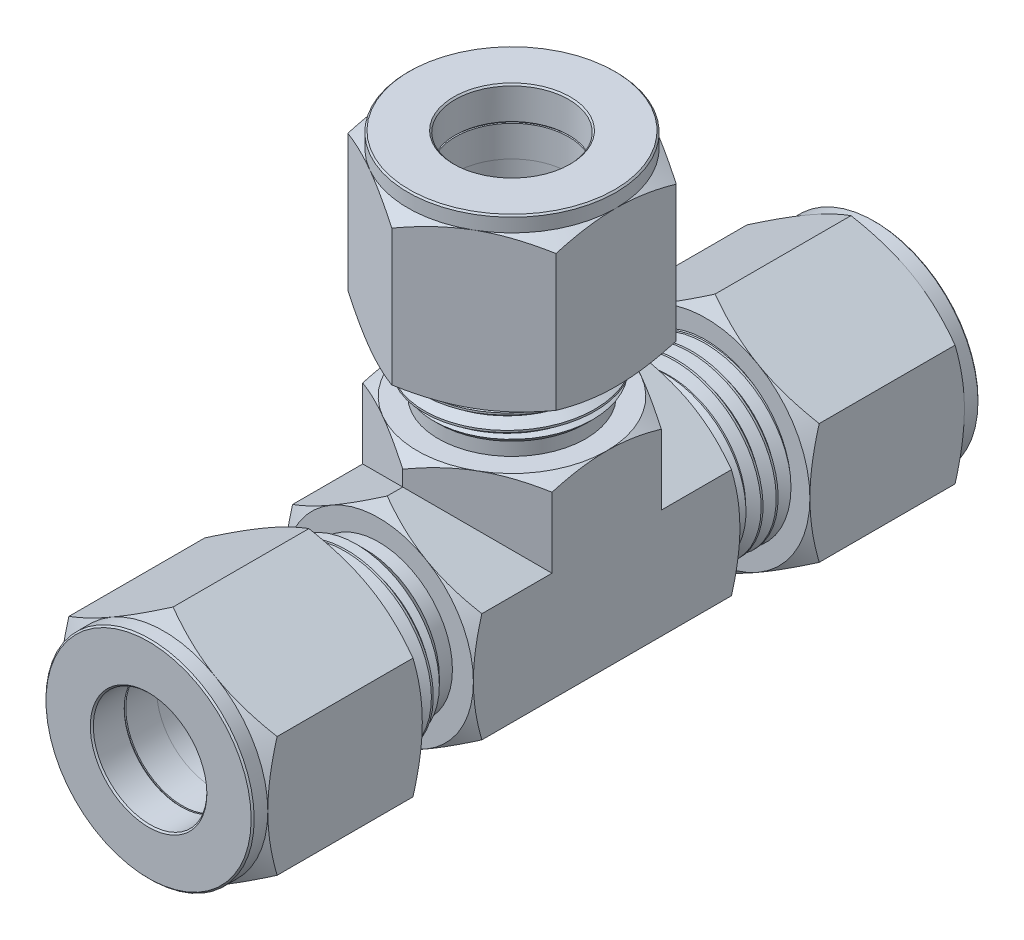
from build123d import *

# Parameters (mm, degrees)
BOSS_EXTRUDE1_DEPTH    = 14.224
CHAMFER1_SIZE          = 0.127
SKETCH4_W              = 23.114
SKETCH4_H              = 7.14375
CUT_SWEEP1_PITCH       = 1.27
CUT_SWEEP1_FROM        = 0
BOSS_EXTRUDE2_DEPTH    = 11.176
CIRPATTERN1_COUNT      = 3
CIRPATTERN1_ANGLE      = 180
SKETCH12_R             = 3.5687
CUT_EXTRUDE1_DEPTH     = 46.228
CUT_EXTRUDE2_START     = -23.1140001
CUT_EXTRUDE2_OUTLINE_R = 3.5687
CUT_EXTRUDE2_DEPTH     = 13.4620002


with BuildPart() as part:
    # Sketch2 → Boss-Extrude1 (new body)
    with BuildSketch(Plane.XY):
        Polygon((0, 10.081979076), (-8.73125, 5.040989538), (-8.73125, -5.040989538), (0, -10.081979076), (8.73125, -5.040989538), (8.73125, 5.040989538), align=None)
    extrude(amount=-BOSS_EXTRUDE1_DEPTH)

    # Sketch3 → Cut-Revolve1 (revolve, cut)
    with BuildSketch(Plane(origin=(0, 0, 0), x_dir=(0, 0, -1), z_dir=(1, 0, 0)), mode=Mode.PRIVATE) as cut_revolve1_sk:
        Polygon((0, 10.081979076), (0, 8.73125), (1.27, 8.73125), (2.049843795, 10.081979076), (13.444156205, 10.081979076), (14.224, 8.73125), (14.224, 10.081979076), (14.224, 11.432708151), (0, 11.432708151), align=None)
        Polygon((0, 4.7625), (0, 0), (14.224, 0), (14.224, 7.14375), (5.6896, 7.14375), (5.6896, 6.50875), (2.8448, 6.50875), (2.8448, 5.87375), (2.8448, 4.7625), align=None)
    revolve(cut_revolve1_sk.sketch.rotate(Axis((0, 0, 0), (0, 0, -1)), 90), axis=Axis((0, 0, 0), (0, 0, -1)), mode=Mode.SUBTRACT)

    # Chamfer1
    chamfer1_edges = [part.edges().sort_by_distance(p)[0] for p in [
        (-8.73125, 0, 0),
        (-4.7625, 0, -2.8448),
        (-4.7625, 0, 0),
    ]]
    chamfer(chamfer1_edges, length=CHAMFER1_SIZE)


with BuildPart() as body_2:
    # Sketch4 → Revolve1 (revolve)
    with BuildSketch(Plane(origin=(0, 0, 0), x_dir=(0, 0, -1), z_dir=(1, 0, 0)), mode=Mode.PRIVATE) as revolve1_sk:
        with Locations((18.923, 3.571875)):
            Rectangle(SKETCH4_W, SKETCH4_H)
    revolve(revolve1_sk.sketch.rotate(Axis((0, 0, -30.48), (0, 0, 1)), 90), axis=Axis((0, 0, -30.48), (0, 0, 1)))

    # Cut-Sweep1: arcs per turn and ends read off the stored shape
    # Cut-Sweep1: the profile of Sketch6 screwed along a right-hand helix through 20.2 turns, 8 arcs to a turn; built about Z, then put on its axis
    cut_sweep1_z = Axis((0, 0, 0), (0, 0, 1))
    cut_sweep1_corners = [(6.318860803, 0, -1.905), (7.212490766, 0, -2.4209375), (7.212490766, 0, -1.2303125), (6.318860803, 0, -1.74625)]
    with BuildLine(mode=Mode.PRIVATE) as cut_sweep1_profile:
        Line(cut_sweep1_corners[0], cut_sweep1_corners[1])
        Line(cut_sweep1_corners[1], cut_sweep1_corners[2])
        Line(cut_sweep1_corners[2], cut_sweep1_corners[3])
        Line(cut_sweep1_corners[3], cut_sweep1_corners[0])
    cut_sweep1_cap = Face(cut_sweep1_profile.wire())
    cut_sweep1_turn_angles = [0, 22.5, 45, 67.5, 90, 112.5, 135, 157.5, 180, 202.5, 225, 247.5, 270, 292.5, 315, 337.5, 360]
    cut_sweep1_turn_weights = [1, 0.9238795325112867, 1, 0.9238795325112867, 1, 0.9238795325112867, 1, 0.9238795325112867, 1, 0.9238795325112867, 1, 0.9238795325112867, 1, 0.9238795325112867, 1, 0.9238795325112867, 1]
    cut_sweep1_turn_rails = [Edge.make_bspline([Vector(p[0], p[1], 0).rotate(cut_sweep1_z, cut_sweep1_turn_angles[k]) / cut_sweep1_turn_weights[k] + Vector(0, 0, p[2] + CUT_SWEEP1_PITCH * cut_sweep1_turn_angles[k] / 360) for k in range(17)], [0, 0, 0, 1, 1, 2, 2, 3, 3, 4, 4, 5, 5, 6, 6, 7, 7, 8, 8, 8], 2, cut_sweep1_turn_weights) for p in cut_sweep1_corners]
    cut_sweep1_turn_sides = [Face.make_surface_from_curves(cut_sweep1_turn_rails[p[0]], cut_sweep1_turn_rails[p[1]]) for p in [(0, 1), (1, 2), (2, 3), (3, 0)]]
    cut_sweep1_last_angles = [7200, 7222.5, 7245, 7258.5, 7272]
    cut_sweep1_last_weights = [1, 0.9238795325112867, 1, 0.9723699203976766, 1]
    cut_sweep1_last_rails = [Edge.make_bspline([Vector(p[0], p[1], 0).rotate(cut_sweep1_z, cut_sweep1_last_angles[k]) / cut_sweep1_last_weights[k] + Vector(0, 0, p[2] + CUT_SWEEP1_PITCH * cut_sweep1_last_angles[k] / 360) for k in range(5)], [0, 0, 0, 1, 1, 2, 2, 2], 2, cut_sweep1_last_weights) for p in cut_sweep1_corners]
    cut_sweep1_last_sides = [Face.make_surface_from_curves(cut_sweep1_last_rails[p[0]], cut_sweep1_last_rails[p[1]]) for p in [(0, 1), (1, 2), (2, 3), (3, 0)]]
    cut_sweep1 = Plane(origin=(0, 0, -7.366), x_dir=(0, 1, 0), z_dir=(0, 0, -1)) * split(Solid(Shell([*[p.moved(Location((0, 0, CUT_SWEEP1_PITCH * i))) for i in range(20) for p in cut_sweep1_turn_sides], *cut_sweep1_last_sides, cut_sweep1_cap, cut_sweep1_cap.rotate(cut_sweep1_z, 7272).moved(Location((0, 0, CUT_SWEEP1_PITCH * 7272 / 360)))])), bisect_by=Plane.XY.offset(CUT_SWEEP1_FROM), keep=Keep.TOP, mode=Mode.PRIVATE)
    add(cut_sweep1, mode=Mode.SUBTRACT)

    # Sketch7 → Boss-Extrude2 (add)
    with BuildSketch(Plane(origin=(0, 0, -30.48), x_dir=(-1, 0, 0), z_dir=(0, 0, -1))):
        Polygon((0, 9.165435523), (-7.9375, 4.582717762), (-7.9375, -4.582717762), (0, -9.165435523), (7.9375, -4.582717762), (7.9375, 4.582717762), align=None)
    extrude(amount=-BOSS_EXTRUDE2_DEPTH)

    # Sketch8 → Cut-Revolve2 (revolve, cut)
    with BuildSketch(Plane(origin=(0, 0, 0), x_dir=(0, 0, -1), z_dir=(1, 0, 0)), mode=Mode.PRIVATE) as cut_revolve2_sk:
        Polygon((7.366, 7.281231533), (7.366, 6.18137927), (8.465852263, 7.281231533), align=None)
        Polygon((19.304, 7.281231533), (17.104295474, 7.281231533), (18.204147737, 6.18137927), (19.304, 6.18137927), align=None)
        Polygon((19.304, 7.9375), (20.012948905, 9.165435523), (30.48, 9.165435523), (30.48, 10.393371047), (19.304, 10.393371047), (19.304, 9.165435523), align=None)
        Polygon((17.018, 3.5687), (30.48, 3.5687), (30.48, 0), (7.366, 0), (7.366, 5.642404948), (10.922668421, 4.7625), (17.018, 4.7625), align=None)
    revolve(cut_revolve2_sk.sketch.rotate(Axis((0, 0, 0), (0, 0, -1)), 90), axis=Axis((0, 0, 0), (0, 0, -1)), mode=Mode.SUBTRACT)


with BuildPart() as body_3:
    # Sketch9 → Revolve2 (revolve)
    with BuildSketch(Plane(origin=(0, 0, 0), x_dir=(0, 0, -1), z_dir=(1, 0, 0)), mode=Mode.PRIVATE) as revolve2_sk:
        Polygon((4.7625, 6.2865), (4.7625, 5.4356), (5.4356, 4.7625), (9.6393, 4.7625), (9.6393, 5.08), align=None)
    revolve(revolve2_sk.sketch.rotate(Axis((0, 0, 0), (0, 0, -1)), 90), axis=Axis((0, 0, 0), (0, 0, -1)))


with BuildPart() as body_4:
    # Sketch10 → Revolve3 (revolve)
    with BuildSketch(Plane(origin=(0, 0, 0), x_dir=(0, 0, -1), z_dir=(1, 0, 0)), mode=Mode.PRIVATE) as revolve3_sk:
        Polygon((2.8448, 6.223), (3.9878, 6.223), (3.9878, 5.4356), (4.7625, 5.4356), (5.4356, 4.7625), (2.8448, 4.7625), align=None)
    revolve(revolve3_sk.sketch.rotate(Axis((0, 0, 0), (0, 0, -1)), 90), axis=Axis((0, 0, 0), (0, 0, -1)))


with BuildPart() as cirpattern1_1:
    # CirPattern1: pattern copy
    add(body_2.part.rotate(Axis((0, 0, -30.48), (-1, 0, 0)), 1 * CIRPATTERN1_ANGLE / (CIRPATTERN1_COUNT - 1)))


with BuildPart() as cirpattern1_2:
    # CirPattern1: pattern copy
    add(body_2.part.rotate(Axis((0, 0, -30.48), (-1, 0, 0)), 2 * CIRPATTERN1_ANGLE / (CIRPATTERN1_COUNT - 1)))


with BuildPart() as cirpattern1_3:
    # CirPattern1: pattern copy
    add(part.part.rotate(Axis((0, 0, -30.48), (-1, 0, 0)), 1 * CIRPATTERN1_ANGLE / (CIRPATTERN1_COUNT - 1)))


with BuildPart() as cirpattern1_4:
    # CirPattern1: pattern copy
    add(part.part.rotate(Axis((0, 0, -30.48), (-1, 0, 0)), 2 * CIRPATTERN1_ANGLE / (CIRPATTERN1_COUNT - 1)))


with BuildPart() as cirpattern1_5:
    # CirPattern1: pattern copy
    add(body_4.part.rotate(Axis((0, 0, -30.48), (-1, 0, 0)), 1 * CIRPATTERN1_ANGLE / (CIRPATTERN1_COUNT - 1)))


with BuildPart() as cirpattern1_6:
    # CirPattern1: pattern copy
    add(body_4.part.rotate(Axis((0, 0, -30.48), (-1, 0, 0)), 2 * CIRPATTERN1_ANGLE / (CIRPATTERN1_COUNT - 1)))


with BuildPart() as cirpattern1_7:
    # CirPattern1: pattern copy
    add(body_3.part.rotate(Axis((0, 0, -30.48), (-1, 0, 0)), 1 * CIRPATTERN1_ANGLE / (CIRPATTERN1_COUNT - 1)))


with BuildPart() as cirpattern1_8:
    # CirPattern1: pattern copy
    add(body_3.part.rotate(Axis((0, 0, -30.48), (-1, 0, 0)), 2 * CIRPATTERN1_ANGLE / (CIRPATTERN1_COUNT - 1)))


with BuildPart() as cirpattern1_1_1:
    add(cirpattern1_1.part)

    # Combine1: union body 2, CirPattern1_2
    add(body_2.part)
    add(cirpattern1_2.part)

    # Sketch12 → Cut-Extrude1 (cut)
    with BuildSketch(Plane.XY.offset(-7.366)):
        Circle(SKETCH12_R)
    extrude(amount=-CUT_EXTRUDE1_DEPTH, mode=Mode.SUBTRACT)

    # Cut-Extrude2: read off the stored shape, not the designer's step
    # Cut-Extrude2 outline → Cut-Extrude2 (cut)
    with BuildSketch(Plane(origin=(0, 23.114, 0), x_dir=(1, 0, 0), z_dir=(0, 1, 0)).offset(CUT_EXTRUDE2_START)):
        with Locations((0, 30.48)):
            Circle(CUT_EXTRUDE2_OUTLINE_R)
    extrude(amount=CUT_EXTRUDE2_DEPTH, mode=Mode.SUBTRACT)


solid = Compound([part.part, body_3.part, body_4.part, cirpattern1_3.part, cirpattern1_4.part, cirpattern1_5.part, cirpattern1_6.part, cirpattern1_7.part, cirpattern1_8.part, cirpattern1_1_1.part])
